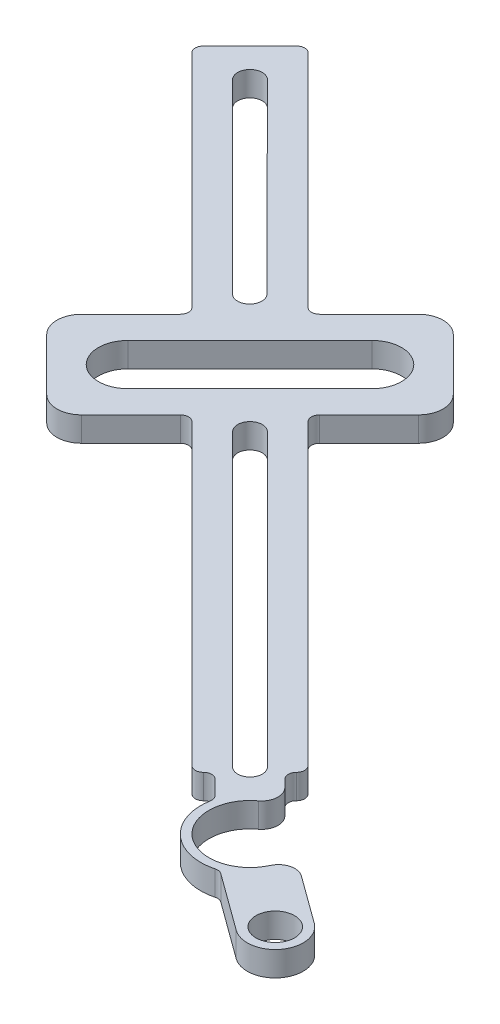
from build123d import *

# Parameters (mm, degrees)
SKETCH1_R           = 2.35
BOSS_EXTRUDE1_DEPTH = 3
FILLET1_R           = 1
FILLET2_R           = 2


with BuildPart() as part:
    # Sketch1 → Boss-Extrude1 (new body)
    with BuildSketch(Plane(origin=(0, 0, 0), x_dir=(1, 0, 0), z_dir=(0, 1, 0))):
        with BuildLine():
            Line((150.782624159, -101.436632834), (142.429643363, -95.352389557))
            ThreePointArc((142.429643363, -95.352389557), (134.417437791, -99.906414375), (136.757444533, -90.99243947))
            Line((136.757444533, -90.99243947), (133.083209919, -87.318204856))
            Line((133.083209919, -87.318204856), (134.497423481, -85.903991293))
            Line((134.497423481, -85.903991293), (97.513018177, -48.919585989))
            ThreePointArc((97.513018177, -48.919585989), (97.220124958, -48.212479208), (97.513018177, -47.505372427))
            Line((97.513018177, -47.505372427), (103.523425817, -41.494964787))
            ThreePointArc((103.523425817, -41.494964787), (104.402105474, -39.373644443), (103.523425817, -37.2523241))
            Line((103.523425817, -37.2523241), (97.159464787, -30.888363069))
            ThreePointArc((97.159464787, -30.888363069), (95.038144443, -30.009683412), (92.9168241, -30.888363069))
            Line((92.9168241, -30.888363069), (86.906416459, -36.898770709))
            ThreePointArc((86.906416459, -36.898770709), (86.199309678, -37.191663928), (85.492202897, -36.898770709))
            Line((85.492202897, -36.898770709), (58.622145212, -10.028713024))
            ThreePointArc((58.622145212, -10.028713024), (57.915038431, -9.735819805), (57.20793165, -10.028713024))
            Line((57.20793165, -10.028713024), (51.5510774, -15.685567273))
            ThreePointArc((51.5510774, -15.685567273), (51.258184181, -16.392674055), (51.5510774, -17.099780836))
            Line((51.5510774, -17.099780836), (78.421135085, -43.969838521))
            ThreePointArc((78.421135085, -43.969838521), (78.714028304, -44.676945302), (78.421135085, -45.384052083))
            Line((78.421135085, -45.384052083), (72.410727445, -51.394459723))
            ThreePointArc((72.410727445, -51.394459723), (71.532047789, -53.515780067), (72.410727445, -55.63710041))
            Line((72.410727445, -55.63710041), (78.774688476, -62.001061441))
            ThreePointArc((78.774688476, -62.001061441), (80.896008819, -62.879741098), (83.017329163, -62.001061441))
            Line((83.017329163, -62.001061441), (89.027736803, -55.990653801))
            ThreePointArc((89.027736803, -55.990653801), (89.734843584, -55.697760582), (90.441950365, -55.990653801))
            Line((90.441950365, -55.990653801), (127.426355669, -92.975059105))
            Line((127.426355669, -92.975059105), (128.840569232, -91.560845543))
            Line((128.840569232, -91.560845543), (131.668996357, -94.389272667))
            ThreePointArc((131.668996357, -94.389272667), (133.388387651, -100.345014415), (139.458762793, -101.601084408))
            Line((139.458762793, -101.601084408), (146.779034385, -106.933110699))
            ThreePointArc((146.779034385, -106.933110699), (151.529068204, -106.186666654), (150.782624159, -101.436632834))
        make_face()
        with Locations(Location((148.780829272, -104.184871767, 0), (0, 0, 270))):
            Circle(SKETCH1_R, mode=Mode.SUBTRACT)
        with BuildLine():
            Line((77.996871016, -51.323749045), (92.846113421, -36.47450664))
            ThreePointArc((92.846113421, -36.47450664), (97.937282246, -36.47450664), (97.937282246, -41.565675465))
            Line((97.937282246, -41.565675465), (83.088039841, -56.41491787))
            ThreePointArc((83.088039841, -56.41491787), (77.996871016, -56.41491787), (77.996871016, -51.323749045))
        make_face(mode=Mode.SUBTRACT)
        with BuildLine():
            Line((96.098804615, -52.455119895), (131.454143674, -87.810458954))
            ThreePointArc((131.454143674, -87.810458954), (131.454143674, -89.931779298), (129.332823331, -89.931779298))
            Line((129.332823331, -89.931779298), (93.977484271, -54.576440239))
            ThreePointArc((93.977484271, -54.576440239), (93.977484271, -52.455119895), (96.098804615, -52.455119895))
        make_face(mode=Mode.SUBTRACT)
        with BuildLine():
            Line((58.975698603, -15.332013883), (81.572324274, -37.990180363))
            ThreePointArc((81.572324274, -37.990180363), (81.572344991, -40.083780173), (79.478745181, -40.08380089))
            Line((79.478745181, -40.08380089), (56.854378259, -17.453334226))
            ThreePointArc((56.854378259, -17.453334226), (56.854378259, -15.332013883), (58.975698603, -15.332013883))
        make_face(mode=Mode.SUBTRACT)
    extrude(amount=BOSS_EXTRUDE1_DEPTH)

    # Fillet1
    fillet1_edges = [part.edges().sort_by_distance(p)[0] for p in [
        (139.458762793, 1.5, 101.601084408),
        (131.668996357, 1.5, 94.389272667),
        (133.083209919, 1.5, 87.318204856),
        (134.497423481, 1.5, 85.903991293),
        (128.840569232, 1.5, 91.560845543),
        (127.426355669, 1.5, 92.975059105),
    ]]
    fillet(fillet1_edges, radius=FILLET1_R - 0.0001)  # a hair under: the kernel refuses the full size

    # Fillet2
    fillet2_edges = [part.edges().sort_by_distance(p)[0] for p in [
        (136.757444533, 1.5, 90.99243947),
        (142.429643363, 1.5, 95.352389557),
    ]]
    fillet(fillet2_edges, radius=FILLET2_R)


solid = part.part
